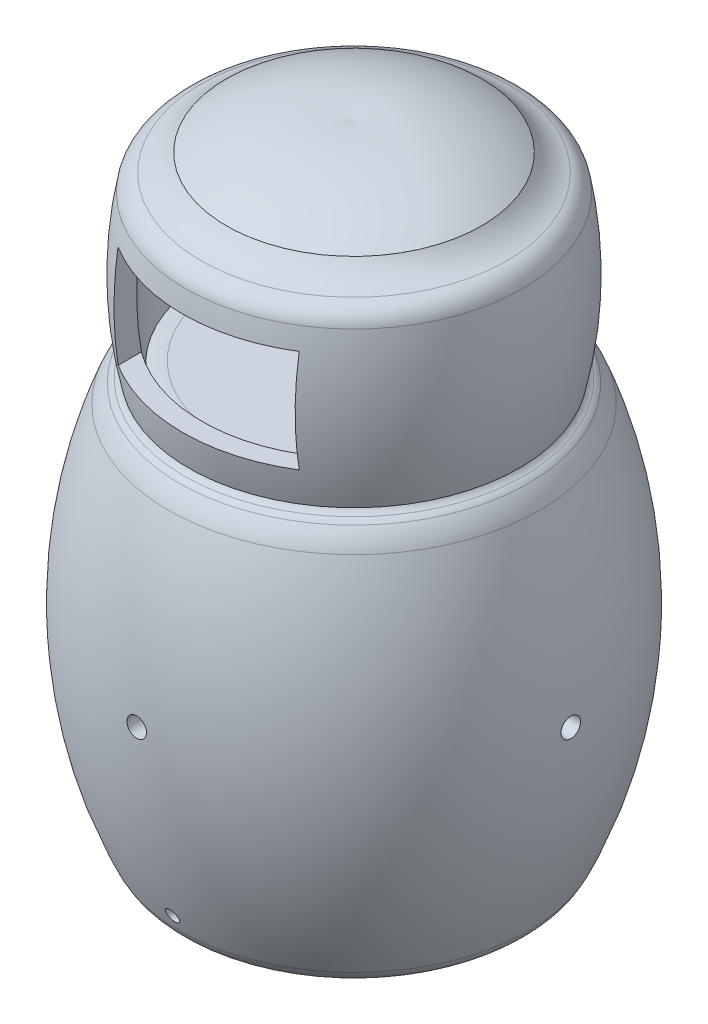
from build123d import *

# Parameters (mm, degrees)
SKETCH3_R               = 81
SKETCH3_R_2             = 77.501248024
CUT_EXTRUDE1_DEPTH      = 20
SKETCH4_W               = 95.04
SKETCH4_H               = 53.86
CUT_EXTRUDE2_DEPTH      = 30
SKETCH5_R               = 20
CUT_EXTRUDE3_DEPTH      = 20
CUT_EXTRUDE4_DEPTH      = 30
CUT_EXTRUDE4_DEPTH_BACK = 410
SKETCH6_R               = 5.1
CUT_EXTRUDE5_DEPTH      = 405.996057393
CUT_EXTRUDE5_DEPTH_BACK = 405.996057393
SKETCH7_R               = 5.1
CUT_EXTRUDE6_DEPTH      = 440.671336887
CUT_EXTRUDE6_DEPTH_BACK = 12
SKETCH8_R               = 3.55


with BuildPart() as part:
    # Sketch2 → Revolve1 (revolve)
    with BuildSketch(Plane.XY):
        with BuildLine():
            ThreePointArc((-12.71236437, 218.918953196), (-16.666353114, 219.728509851), (-20.693225606, 220))
            Line((-20.693225606, 220), (-90, 220))
            Line((-90, 220), (-90, 205))
            Line((-90, 205), (-20.693225606, 205))
            ThreePointArc((-20.693225606, 205), (-12.209917689, 202.370670426), (-6.700664758, 195.404464906))
            ThreePointArc((-6.700664758, 195.404464906), (8.978164508, 103.730969885), (-12.13455183, 13.154435476))
            Line((-12.13455183, 13.154435476), (-19.281789599, 12.479876035))
            Line((-19.281789599, 12.479876035), (-19.281789599, 0))
            Line((-19.281789599, 0), (-4.926165928, 0))
            ThreePointArc((-4.926165928, 0), (-1.147491573, 2.942456876), (1.511165162, 6.92591978))
            ThreePointArc((1.511165162, 6.92591978), (23.971501692, 103.283935109), (7.29189609, 200.808929812))
            ThreePointArc((7.29189609, 200.808929812), (4.841723152, 205.746948655), (1.529394516, 210.153291416))
            ThreePointArc((1.529394516, 210.153291416), (0.336924673, 211.269613546), (-1.021373152, 212.176909774))
            ThreePointArc((-1.021373152, 212.176909774), (-2.392726704, 213.199075341), (-3.446088837, 214.546614293))
            ThreePointArc((-3.446088837, 214.546614293), (-7.891182499, 217.131304655), (-12.71236437, 218.918953196))
        make_face()
    revolve(axis=Axis((-90, -83.445440151, 0), (0, 1, 0)))

    # Sketch3 → Cut-Extrude1 (cut)
    with BuildSketch(Plane.XZ):
        with Locations((-90, 0)):
            Circle(SKETCH3_R)
        with Locations((-90, 0)):
            Circle(SKETCH3_R_2, mode=Mode.SUBTRACT)
    extrude(amount=-CUT_EXTRUDE1_DEPTH, mode=Mode.SUBTRACT)


with BuildPart() as cut_extrude1_piece_1:
    # of the separate pieces the step leaves, piece 1, a body of its own (cut_extrude1_pieces)
    add(part.part.solids().sort_by_distance((1.529394516, 210.153291416, 0))[0])

    # Sketch2<3> → Revolve2 (revolve)
    with BuildSketch(Plane.XY):
        with BuildLine():
            ThreePointArc((-11.650070494, 294.974615285), (-8.336372001, 256.893082049), (-12.71236437, 218.918953196))
            ThreePointArc((-12.71236437, 218.918953196), (-7.891182499, 217.131304655), (-3.446088837, 214.546614293))
            ThreePointArc((-3.446088837, 214.546614293), (1.643385969, 255.608658637), (-1.825450965, 296.839246917))
            ThreePointArc((-1.825450965, 296.839246917), (-4.5567514, 302.366706839), (-9.750480911, 305.689053753))
            ThreePointArc((-9.750480911, 305.689053753), (-17.121177743, 309.242143533), (-23.096112396, 314.832472203))
            ThreePointArc((-23.096112396, 314.832472203), (-55.25085692, 328.13817549), (-90, 330))
            Line((-90, 330), (-90, 320.06706833))
            Line((-90, 320.06706833), (-88.843769727, 320.06706833))
            ThreePointArc((-88.843769727, 320.06706833), (-58.215870113, 318.553321049), (-29.737141439, 307.181352058))
            ThreePointArc((-29.737141439, 307.181352058), (-21.98171487, 300.465127303), (-12.683770052, 296.128937916))
            ThreePointArc((-12.683770052, 296.128937916), (-12.006327072, 295.695588319), (-11.650070494, 294.974615285))
        make_face()
    revolve(axis=Axis((-90, -83.445440151, 0), (0, 1, 0)))

    # Sketch4 → Cut-Extrude2 (cut)
    with BuildSketch(Plane.XY.offset(91.7)):
        with Locations((-90, 259.338474219)):
            Rectangle(SKETCH4_W, SKETCH4_H)
    extrude(amount=-CUT_EXTRUDE2_DEPTH, mode=Mode.SUBTRACT)

    # Sketch5 → Cut-Extrude3 (cut)
    with BuildSketch(Plane(origin=(0, 220, 0), x_dir=(1, 0, 0), z_dir=(0, 1, 0))):
        with Locations((-90, 0)):
            Circle(SKETCH5_R)
    extrude(amount=-CUT_EXTRUDE3_DEPTH, mode=Mode.SUBTRACT)

    # Sketch6 → Cut-Extrude4 (cut, two sides: drawn at the far end of the back side and taken through both)
    with BuildSketch(Plane.XY.offset(91.7).offset(-CUT_EXTRUDE4_DEPTH_BACK)):
        with Locations((-90, 110.734514709)):
            Circle(SKETCH6_R)
    extrude(amount=CUT_EXTRUDE4_DEPTH + CUT_EXTRUDE4_DEPTH_BACK, mode=Mode.SUBTRACT)

    # Sketch7 → Cut-Extrude5 (cut, two sides: drawn at the far end of the back side and taken through both)
    with BuildSketch(Plane(origin=(0, 0, 0), x_dir=(0, 0, -1), z_dir=(1, 0, 0)).offset(-CUT_EXTRUDE5_DEPTH_BACK)):
        with Locations((-0.244758935, 110.734514709)):
            Circle(SKETCH7_R)
    extrude(amount=CUT_EXTRUDE5_DEPTH + CUT_EXTRUDE5_DEPTH_BACK, mode=Mode.SUBTRACT)

    # Sketch8 → Cut-Extrude6 (cut, two sides: drawn at the far end of the back side and taken through both)
    with BuildSketch(Plane.XY.offset(91.7).offset(-CUT_EXTRUDE6_DEPTH_BACK)):
        with Locations((-90, 15.629680066)):
            Circle(SKETCH8_R)
    extrude(amount=CUT_EXTRUDE6_DEPTH + CUT_EXTRUDE6_DEPTH_BACK, mode=Mode.SUBTRACT)


with BuildPart() as cut_extrude1_piece_2:
    # of the separate pieces the step leaves, piece 2, a body of its own (cut_extrude1_pieces)
    add(part.part.solids().sort_by_distance((-12.498751976, 0, 0))[0])


solid = Compound([cut_extrude1_piece_1.part, cut_extrude1_piece_2.part])
